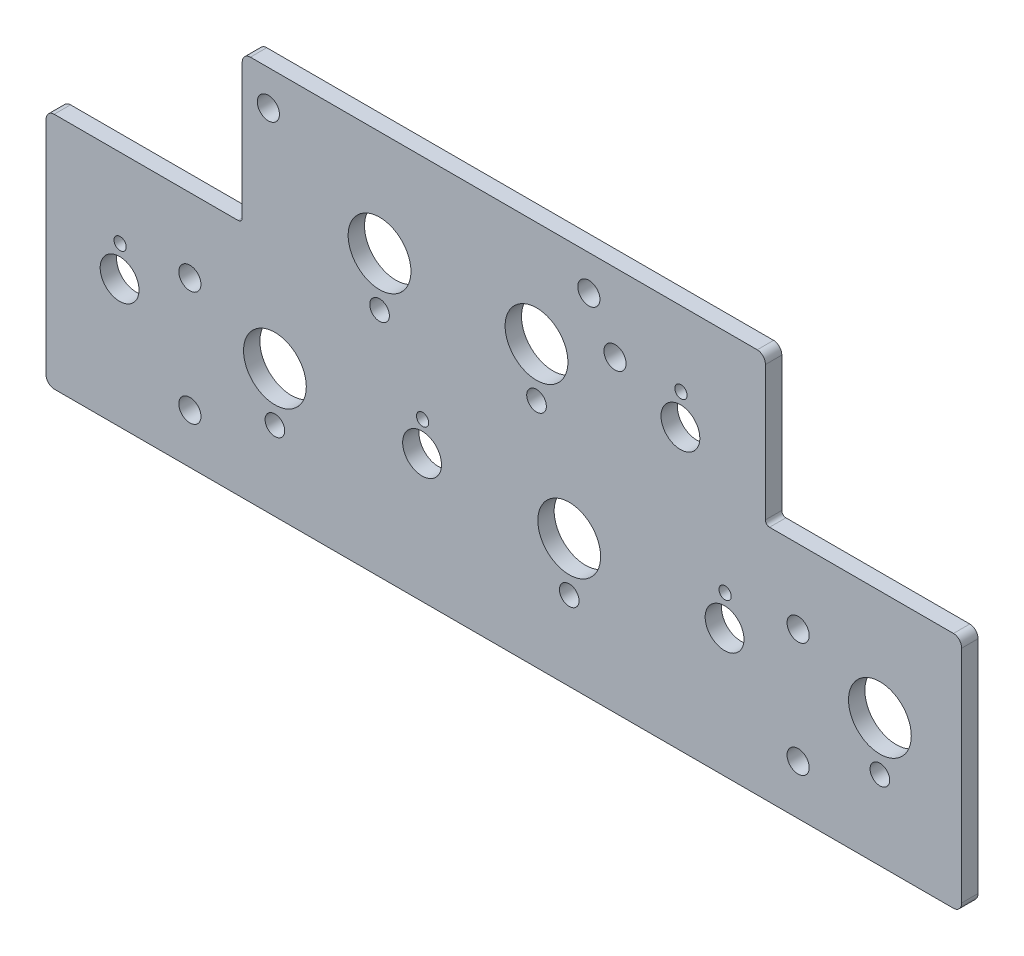
from build123d import *

# Parameters (mm, degrees)
BOSS_EXTRUDE1_DEPTH   = 3.175
SKETCH2_R             = 3.7703125
CUT_EXTRUDE1_DEPTH    = 98.862396902
SKETCH4_R             = 6.096
SKETCH4_R_2           = 1.905
CUT_EXTRUDE2_DEPTH    = 98.862396902
F_6_CLEARANCE_HOLE1_D = 4.3053
SKETCH7_R             = 1.190625
CUT_EXTRUDE3_DEPTH    = 98.862396902


with BuildPart() as part:
    # Sketch1 → Boss-Extrude1 (new body)
    with BuildSketch(Plane.XY):
        with BuildLine():
            Line((-51.59375, 5.432306697), (-87.3125, 5.432306697))
            add(Edge.make_bspline(
                [(-87.3125, 5.432306697), (-88.9, 5.432306697), (-88.9, 3.742924483)],
                knots=[3.141592654, 3.141592654, 3.141592654, 4.71238898, 4.71238898, 4.71238898], degree=2, weights=[1, 0.707106781, 1]))
            Line((-88.9, 3.742924483), (-88.9, -39.099808459))
            add(Edge.make_bspline(
                [(-88.9, -39.099808459), (-88.9, -40.789190673), (-87.3125, -40.789190673)],
                knots=[1.570796327, 1.570796327, 1.570796327, 3.141592654, 3.141592654, 3.141592654], degree=2, weights=[1, 0.707106781, 1]))
            Line((-87.3125, -40.789190673), (87.3125, -40.789190673))
            add(Edge.make_bspline(
                [(87.3125, -40.789190673), (88.9, -40.789190673), (88.9, -39.099808459)],
                knots=[3.141592654, 3.141592654, 3.141592654, 4.71238898, 4.71238898, 4.71238898], degree=2, weights=[1, 0.707106781, 1]))
            Line((88.9, -39.099808459), (88.9, 3.742924483))
            add(Edge.make_bspline(
                [(88.9, 3.742924483), (88.9, 5.432306697), (87.3125, 5.432306697)],
                knots=[1.570796327, 1.570796327, 1.570796327, 3.141592654, 3.141592654, 3.141592654], degree=2, weights=[1, 0.707106781, 1]))
            Line((87.3125, 5.432306697), (51.59375, 5.432306697))
            add(Edge.make_bspline(
                [(50.8, 6.276997804), (50.8, 5.432306697), (51.59375, 5.432306697)],
                knots=[4.71238898, 4.71238898, 4.71238898, 6.283185307, 6.283185307, 6.283185307], degree=2, weights=[1, 0.707106781, 1]))
            Line((50.8, 6.276997804), (50.8, 32.394846829))
            add(Edge.make_bspline(
                [(50.8, 32.394846829), (50.8, 34.084229043), (49.2125, 34.084229043)],
                knots=[4.71238898, 4.71238898, 4.71238898, 6.283185307, 6.283185307, 6.283185307], degree=2, weights=[1, 0.707106781, 1]))
            Line((49.2125, 34.084229043), (-49.2125, 34.084229043))
            add(Edge.make_bspline(
                [(-49.2125, 34.084229043), (-50.8, 34.084229043), (-50.8, 32.394846829)],
                knots=[0, 0, 0, 1.570796327, 1.570796327, 1.570796327], degree=2, weights=[1, 0.707106781, 1]))
            Line((-50.8, 32.394846829), (-50.8, 6.276997804))
            add(Edge.make_bspline(
                [(-51.59375, 5.432306697), (-50.8, 5.432306697), (-50.8, 6.276997804)],
                knots=[0, 0, 0, 1.570796327, 1.570796327, 1.570796327], degree=2, weights=[1, 0.707106781, 1]))
        make_face()
    extrude(amount=BOSS_EXTRUDE1_DEPTH)

    # Sketch2 → Cut-Extrude1 (cut, through all)
    with BuildSketch(Plane.XY.offset(3.175)):
        with Locations((42.8625, -15.909796167)):
            Circle(SKETCH2_R)
        with Locations((-15.875, -15.909796167)):
            Circle(SKETCH2_R)
        with Locations((-74.6125, -15.909796167)):
            Circle(SKETCH2_R)
        with Locations((34.29, 13.617703833)):
            Circle(SKETCH2_R)
    extrude(amount=-CUT_EXTRUDE1_DEPTH, mode=Mode.SUBTRACT)

    # Sketch4 → Cut-Extrude2 (cut, through all)
    with BuildSketch(Plane.XY.offset(3.175)):
        with Locations((73.025, -15.909796167)):
            Circle(SKETCH4_R)
        with Locations((12.7, -15.909796167)):
            Circle(SKETCH4_R)
        with Locations((-44.45, -15.909796167)):
            Circle(SKETCH4_R)
        with Locations((-24.13, 13.617703833)):
            Circle(SKETCH4_R)
        with Locations((6.35, 13.617703833)):
            Circle(SKETCH4_R)
        with Locations((73.025, -25.434796167)):
            Circle(SKETCH4_R_2)
        with Locations((12.7, -25.434796167)):
            Circle(SKETCH4_R_2)
        with Locations((-44.45, -25.434796167)):
            Circle(SKETCH4_R_2)
        with Locations((6.35, 4.092703833)):
            Circle(SKETCH4_R_2)
        with Locations((-24.13, 4.092703833)):
            Circle(SKETCH4_R_2)
    extrude(amount=-CUT_EXTRUDE2_DEPTH, mode=Mode.SUBTRACT)

    # #6 Clearance Hole1 (through all)
    with Locations(Plane.XY.offset(3.175)):
        with Locations((-45.72, 27.270203833), (16.51, 27.270203833), (21.59, 19.015203833), (57.15, -8.924796167), (57.15, -31.149796167), (-60.96, -31.149796167), (-60.96, -8.924796167)):
            Hole(F_6_CLEARANCE_HOLE1_D / 2)

    # Sketch7 → Cut-Extrude3 (cut, through all)
    with BuildSketch(Plane.XY.offset(3.175)):
        with Locations((42.967003171, -9.910706312)):
            Circle(SKETCH7_R)
        with Locations((-15.773980268, -10.110675974)):
            Circle(SKETCH7_R)
        with Locations((-74.507996829, -9.910706312)):
            Circle(SKETCH7_R)
        with Locations((34.394503171, 19.616793688)):
            Circle(SKETCH7_R)
    extrude(amount=-CUT_EXTRUDE3_DEPTH, mode=Mode.SUBTRACT)


solid = part.part
